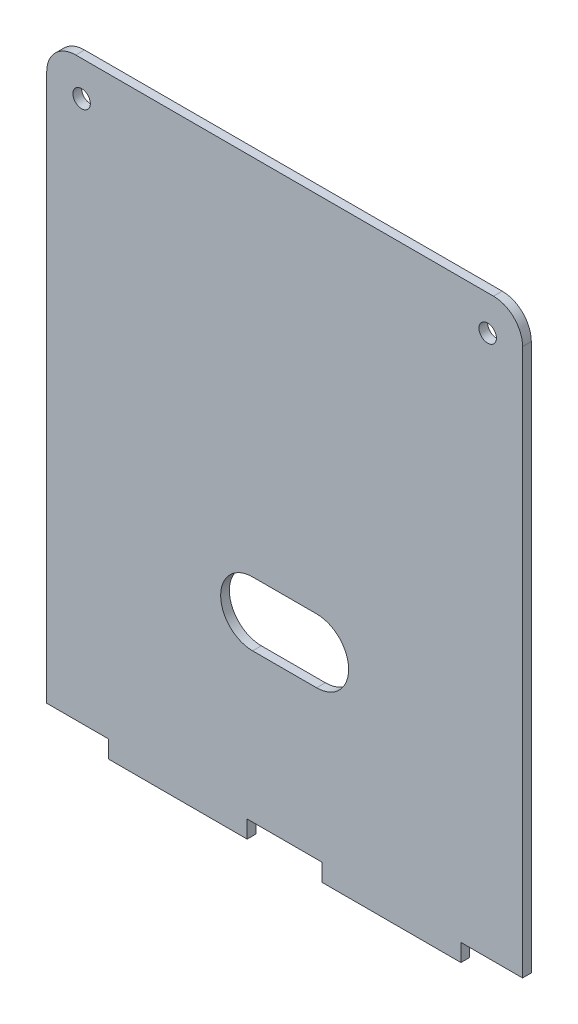
from build123d import *

# Parameters (mm, degrees)
SKETCH1_W           = 81.8
SKETCH1_H           = 102
BOSS_EXTRUDE1_DEPTH = 1.5
SKETCH2_W           = 12.89
SKETCH2_H           = 3
SKETCH2_W_2         = 10.6
SKETCH2_R           = 1.5
CUT_EXTRUDE1_DEPTH  = 131.757370729
CUT_EXTRUDE2_DEPTH  = 131.757370729
FILLET1_R           = 5


with BuildPart() as part:
    # Sketch1 → Boss-Extrude1 (new body)
    with BuildSketch(Plane.XY):
        with Locations((40.9, 51)):
            Rectangle(SKETCH1_W, SKETCH1_H)
    extrude(amount=BOSS_EXTRUDE1_DEPTH)

    # Sketch2 → Cut-Extrude1 (cut, through all)
    with BuildSketch(Plane.XY.offset(1.5)):
        with Locations((40.9, 1.5)):
            Rectangle(SKETCH2_W, SKETCH2_H)
        with Locations((76.5, 1.5)):
            Rectangle(SKETCH2_W_2, SKETCH2_H)
        with Locations((5.3, 1.5)):
            Rectangle(SKETCH2_W_2, SKETCH2_H)
        with Locations((6, 96)):
            Circle(SKETCH2_R)
        with Locations((75.8, 96)):
            Circle(SKETCH2_R)
    extrude(amount=-CUT_EXTRUDE1_DEPTH, mode=Mode.SUBTRACT)

    # Sketch3 → Cut-Extrude2 (cut, through all)
    with BuildSketch(Plane.XY.offset(1.5)):
        with BuildLine():
            Line((46.4, 39.5), (35.4, 39.5))
            ThreePointArc((35.4, 39.5), (29.9, 34), (35.4, 28.5))
            Line((35.4, 28.5), (46.4, 28.5))
            ThreePointArc((46.4, 28.5), (51.9, 34), (46.4, 39.5))
        make_face()
    extrude(amount=-CUT_EXTRUDE2_DEPTH, mode=Mode.SUBTRACT)

    # Fillet1
    fillet1_edges = [part.edges().sort_by_distance(p)[0] for p in [
        (0, 102, 0.75),
        (81.8, 102, 0.75),
    ]]
    fillet(fillet1_edges, radius=FILLET1_R)


solid = part.part
